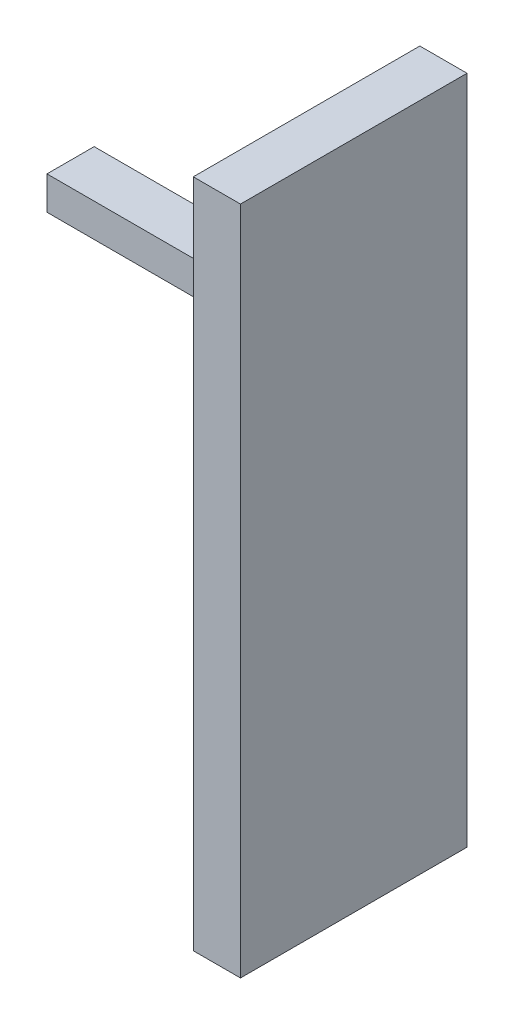
from build123d import *

# Parameters (mm, degrees)
SKETCH2_W           = 142.009514535
SKETCH2_H           = 48
BOSS_EXTRUDE1_DEPTH = 10
SKETCH3_R           = 2.65
CUT_EXTRUDE1_DEPTH  = 7
SKETCH4_W           = 7.047262436
SKETCH4_H           = 10
BOSS_EXTRUDE2_DEPTH = 50


with BuildPart() as part:
    # Sketch2 → Boss-Extrude1 (new body)
    with BuildSketch(Plane.YZ):
        with Locations((39.504757268, 0)):
            Rectangle(SKETCH2_W, SKETCH2_H)
    extrude(amount=BOSS_EXTRUDE1_DEPTH)

    # Sketch3 → Cut-Extrude1 (cut)
    with BuildSketch(Plane(origin=(0, 0, 0), x_dir=(0, -1, 0), z_dir=(-1, 0, 0))):
        with Locations((-14, 13)):
            Circle(SKETCH3_R)
        with Locations((13.976189248, 13)):
            Circle(SKETCH3_R)
        with Locations((13.976189248, -13)):
            Circle(SKETCH3_R)
        with Locations((-14, -13)):
            Circle(SKETCH3_R)
    extrude(amount=-CUT_EXTRUDE1_DEPTH, mode=Mode.SUBTRACT)

    # Sketch4 → Boss-Extrude2 (add)
    with BuildSketch(Plane(origin=(0, 0, 0), x_dir=(0, -1, 0), z_dir=(-1, 0, 0))):
        with Locations((-73.023631218, 0)):
            Rectangle(SKETCH4_W, SKETCH4_H)
    extrude(amount=BOSS_EXTRUDE2_DEPTH)


solid = part.part
